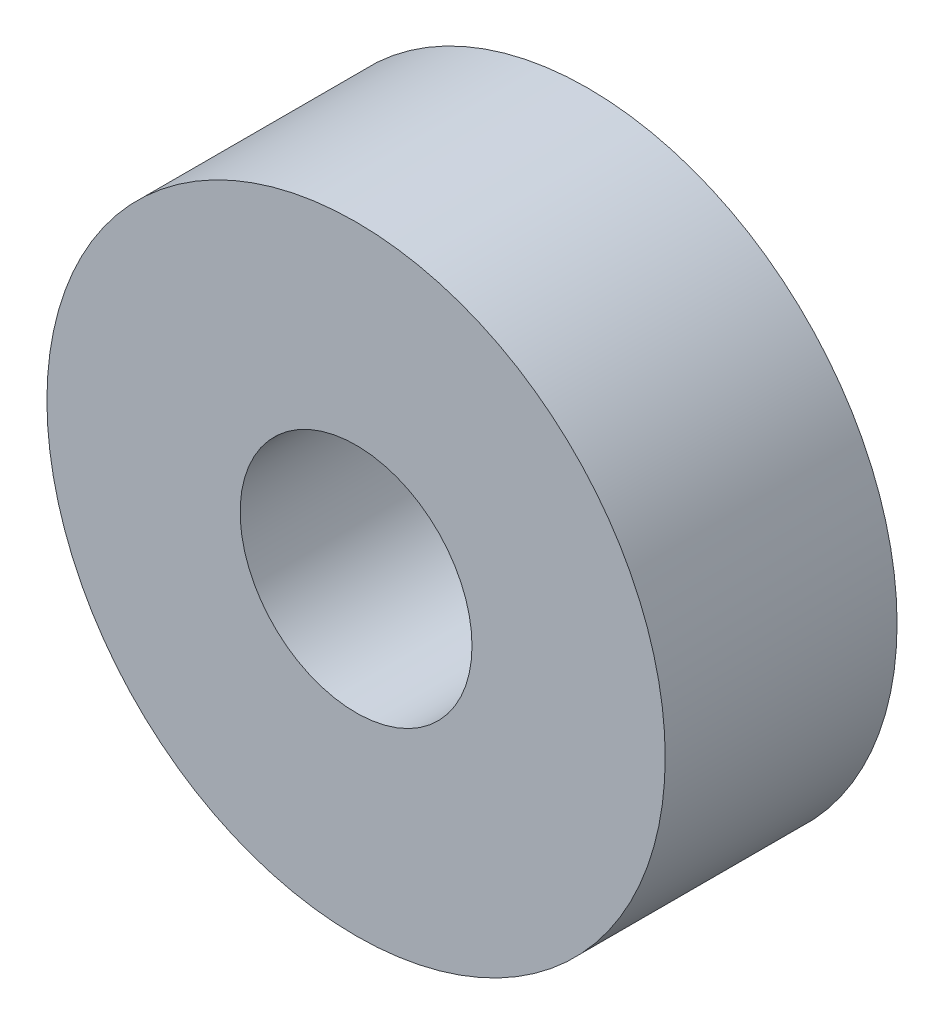
from build123d import *

# Parameters (mm, degrees)
EXTRUDE_1_DEPTH      = 1.5
EXTRUDE_1_DEPTH_BACK = 1.5
SKETCH_1_R           = 4
SKETCH_1_R_2         = 1.5


with BuildPart() as part:
    # 草图1 → 凸台-拉伸1 (new, two sides: drawn at the far end of the back side and taken through both)
    with BuildSketch(Plane.XY.offset(-EXTRUDE_1_DEPTH_BACK)):
        Circle(SKETCH_1_R)
        Circle(SKETCH_1_R_2, mode=Mode.SUBTRACT)
    extrude(amount=EXTRUDE_1_DEPTH + EXTRUDE_1_DEPTH_BACK)


solid = part.part
